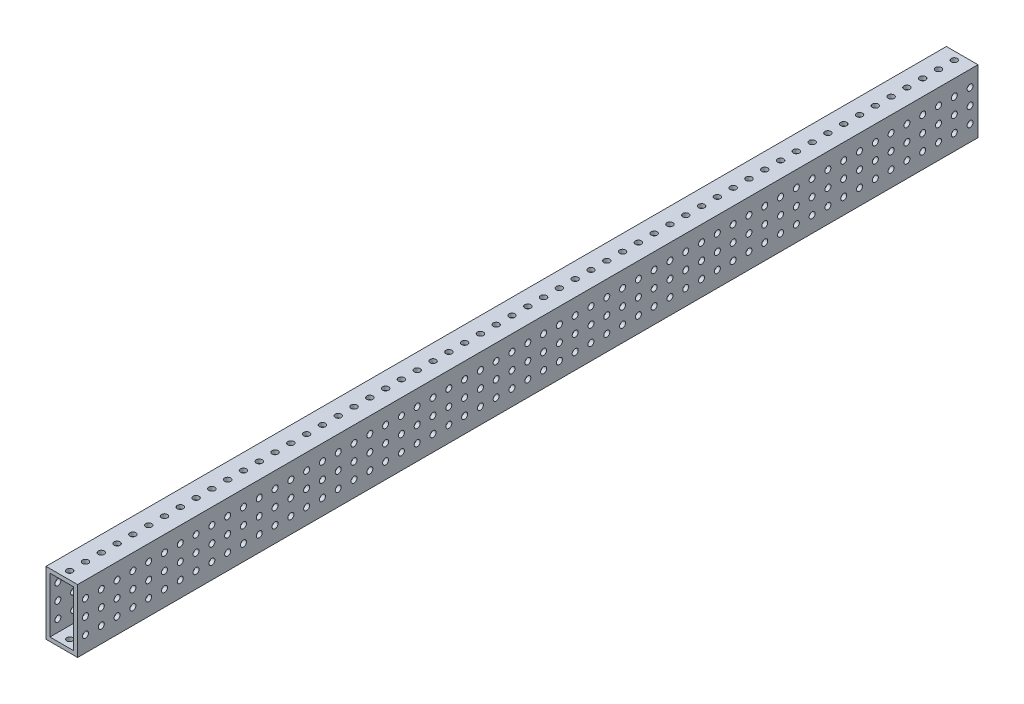
from build123d import *

# Parameters (mm, degrees)
BASETUBE_START                = -361.95
BASETUBE_OUTLINE_W            = 25.4
BASETUBE_OUTLINE_H            = 50.8
BASETUBE_OUTLINE_W_2          = 19.05
BASETUBE_OUTLINE_H_2          = 44.45
BASETUBE_DEPTH                = 723.9
SKETCH3_R                     = 2.413
INITIAL_TOP_HOLE_DEPTH        = 367.379042113
TOP_LINEAR_PATTERN_COUNT      = 29
TOP_LINEAR_PATTERN_PITCH      = 12.7
TOP_LINEAR_PATTERN_COL_COUNT  = 29
TOP_LINEAR_PATTERN_COL_PITCH  = 12.7
SKETCH4_R                     = 2.413
INITIAL_SIDE_HOLES_DEPTH      = 367.379042113
SIDE_LINEAR_PATTERN_COUNT     = 29
SIDE_LINEAR_PATTERN_PITCH     = 12.7
SIDE_LINEAR_PATTERN_COL_COUNT = 29
SIDE_LINEAR_PATTERN_COL_PITCH = 12.7


# Read off the part's stored shape, not the designer's step: BaseTube
with BuildPart() as part:
    # BaseTube outline → BaseTube (new body)
    with BuildSketch(Plane.XY.offset(BASETUBE_START)):
        with Locations((12.7, 25.4)):
            Rectangle(BASETUBE_OUTLINE_W, BASETUBE_OUTLINE_H)
        with Locations((12.7, 25.4)):
            Rectangle(BASETUBE_OUTLINE_W_2, BASETUBE_OUTLINE_H_2, mode=Mode.SUBTRACT)
    extrude(amount=BASETUBE_DEPTH)

    # Sketch3 → Initial Top Hole (cut, through all)
    with BuildSketch(Plane(origin=(0, 0, 0), x_dir=(1, 0, 0), z_dir=(0, 1, 0))):
        with Locations((12.7, 0)):
            Circle(SKETCH3_R)
    initial_top_hole = extrude(amount=INITIAL_TOP_HOLE_DEPTH, mode=Mode.SUBTRACT)

    # Top Linear Pattern: Initial Top Hole ×29
    with Locations(*[(0, 0, i * TOP_LINEAR_PATTERN_PITCH) for i in range(1, TOP_LINEAR_PATTERN_COUNT)]):
        add(initial_top_hole, mode=Mode.SUBTRACT)

    # Top Linear Pattern col: Initial Top Hole ×29
    with Locations(*[(0, 0, -i * TOP_LINEAR_PATTERN_COL_PITCH) for i in range(1, TOP_LINEAR_PATTERN_COL_COUNT)]):
        add(initial_top_hole, mode=Mode.SUBTRACT)

    # Sketch4 → Initial Side Holes (cut, through all)
    with BuildSketch(Plane(origin=(0, 0, 0), x_dir=(0, 0, -1), z_dir=(1, 0, 0))):
        with Locations(Location((0, 38.1, 0), (0, 0, 180))):
            Circle(SKETCH4_R)
        with Locations(Location((0, 25.4, 0), (0, 0, 180))):
            Circle(SKETCH4_R)
        with Locations(Location((0, 12.7, 0), (0, 0, 180))):
            Circle(SKETCH4_R)
    initial_side_holes = extrude(amount=INITIAL_SIDE_HOLES_DEPTH, mode=Mode.SUBTRACT)

    # Side Linear Pattern: Initial Side Holes ×29
    with Locations(*[(0, 0, -i * SIDE_LINEAR_PATTERN_PITCH) for i in range(1, SIDE_LINEAR_PATTERN_COUNT)]):
        add(initial_side_holes, mode=Mode.SUBTRACT)

    # Side Linear Pattern col: Initial Side Holes ×29
    with Locations(*[(0, 0, i * SIDE_LINEAR_PATTERN_COL_PITCH) for i in range(1, SIDE_LINEAR_PATTERN_COL_COUNT)]):
        add(initial_side_holes, mode=Mode.SUBTRACT)


solid = part.part
